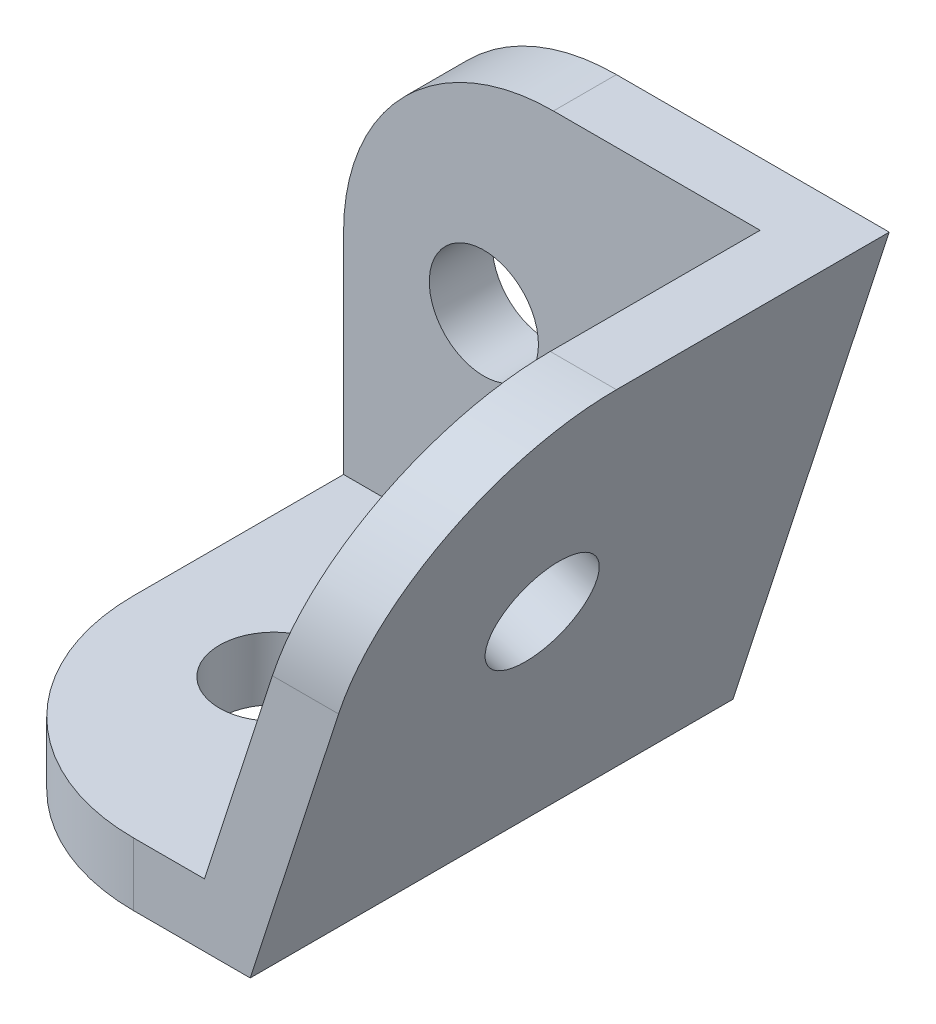
from build123d import *

# Parameters (mm, degrees)
BOSS_EXTRU_1_DEPTH      = 3
ESQUISSE2_W             = 20
ESQUISSE2_H             = 24.175680092
BOSS_EXTRU_2_DEPTH      = 3
ESQUISSE3_W             = 15.552617377
ESQUISSE3_H             = 3
BOSS_EXTRU_3_DEPTH      = 20
ENL_V_MAT_EXTRU_1_DEPTH = 20
CONG_1_R                = 10
ESQUISSE5_R             = 2.6
ENL_V_MAT_EXTRU_2_DEPTH = 20
ESQUISSE6_R             = 2.6
ENL_V_MAT_EXTRU_3_DEPTH = 20
ESQUISSE7_R             = 2.6
ENL_V_MAT_EXTRU_4_DEPTH = 20


with BuildPart() as part:
    # Esquisse1 → Boss.-Extru.1 (new body)
    with BuildSketch(Plane.XY):
        Polygon((55.418780356, 3), (55.418780356, 26), (78.418780356, 26), (70.971397733, 3), align=None)
    extrude(amount=BOSS_EXTRU_1_DEPTH)

    # Esquisse2 → Boss.-Extru.2 (add)
    with BuildSketch(Plane(origin=(63.357248994, -20.515029356, 0), x_dir=(0, 0, 1), z_dir=(-0.9513693063481515, 0.30805266260598535, 0))):
        with Locations((13, 36.804876006)):
            Rectangle(ESQUISSE2_W, ESQUISSE2_H)
    extrude(amount=BOSS_EXTRU_2_DEPTH)

    # Esquisse3 → Boss.-Extru.3 (add)
    with BuildSketch(Plane.XY.offset(3)):
        with Locations((63.195089045, 4.5)):
            Rectangle(ESQUISSE3_W, ESQUISSE3_H)
    extrude(amount=BOSS_EXTRU_3_DEPTH)

    # Esquisse4 → Enlèv. mat.-Extru.1 (cut)
    with BuildSketch(Plane.XY.offset(23)):
        Polygon((78.418780356, 26), (75.265430779, 26), (75.564672437, 26.924157988), align=None)
    extrude(amount=-ENL_V_MAT_EXTRU_1_DEPTH, mode=Mode.SUBTRACT)

    # Congé1
    # the kernel refuses this fillet: 10 mm, written as the material it takes off along each edge
    with BuildSketch(Plane(origin=(55.418780356, 31, 23), x_dir=(0, 0, -1), z_dir=(0, -1, 0)), Plane(origin=(55.418780356, 26, -25), x_dir=(0, -1, 0), z_dir=(0, 0, 1))) as cong_1_piece_1:
        with BuildLine():
            CenterArc((CONG_1_R, CONG_1_R), CONG_1_R, 180, 90)
            Line((0, CONG_1_R), (0, 0))
            Line((0, 0), (CONG_1_R, 0))
        make_face()
    extrude(amount=53, mode=Mode.SUBTRACT)
    with BuildSketch(Plane(origin=(103.418780356, 26, 23), x_dir=(0, 0, -1), z_dir=(-1, 0, 0))) as cong_1_piece_2:
        with BuildLine():
            CenterArc((CONG_1_R, CONG_1_R), CONG_1_R, 180, 90)
            Line((0, CONG_1_R), (0, 0))
            Line((0, 0), (CONG_1_R, 0))
        make_face()
    extrude(amount=53.153349577, mode=Mode.SUBTRACT)

    # Esquisse5 → Enlèv. mat.-Extru.2 (cut)
    with BuildSketch(Plane.XY.offset(3)):
        with Locations((62.104113123, 16)):
            Circle(ESQUISSE5_R)
    extrude(amount=-ENL_V_MAT_EXTRU_2_DEPTH, mode=Mode.SUBTRACT)

    # Esquisse6 → Enlèv. mat.-Extru.3 (cut)
    with BuildSketch(Plane(origin=(0, 6, 0), x_dir=(1, 0, 0), z_dir=(0, 1, 0))):
        with Locations(Location((62.104113123, -13, 0), (0, 0, 270))):
            Circle(ESQUISSE6_R)
    extrude(amount=-ENL_V_MAT_EXTRU_3_DEPTH, mode=Mode.SUBTRACT)

    # Esquisse7 → Enlèv. mat.-Extru.4 (cut)
    with BuildSketch(Plane(origin=(60.503141075, -19.590871368, 0), x_dir=(0, 0, 1), z_dir=(-0.9513693063481516, 0.30805266260598513, 0))):
        with Locations(Location((13, 37.410153061, 0), (0, 0, 270))):
            Circle(ESQUISSE7_R)
    extrude(amount=-ENL_V_MAT_EXTRU_4_DEPTH, mode=Mode.SUBTRACT)


solid = part.part
